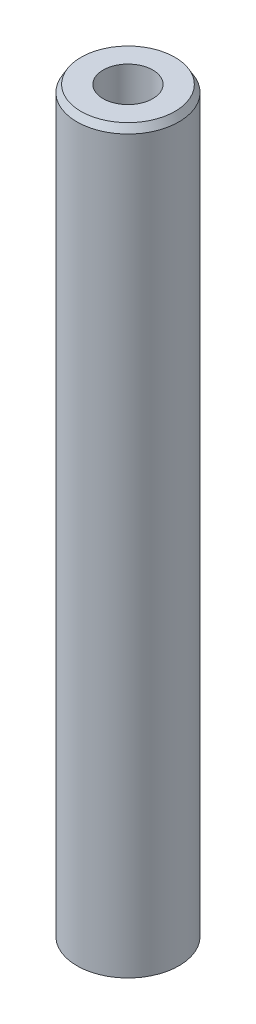
from build123d import *
from OCP.BRepFilletAPI import BRepFilletAPI_MakeChamfer

# Parameters (mm, degrees)
SKETCH1_R           = 7.5
BOSS_EXTRUDE1_DEPTH = 109.103731088
SKETCH2_R           = 3.653436634
CUT_EXTRUDE1_DEPTH  = 110.618083076
CHAMFER1_SIZE       = 1.032537597
CHAMFER1_SIZE2      = 0.596135859


with BuildPart() as part:
    # Sketch1 → Boss-Extrude1 (new body)
    with BuildSketch(Plane(origin=(0, 0, 0), x_dir=(1, 0, 0), z_dir=(0, 1, 0))):
        Circle(SKETCH1_R)
    extrude(amount=BOSS_EXTRUDE1_DEPTH)

    # Sketch2 → Cut-Extrude1 (cut, through all)
    with BuildSketch(Plane(origin=(0, 0, 0), x_dir=(1, 0, 0), z_dir=(0, 1, 0))):
        Circle(SKETCH2_R)
    extrude(amount=CUT_EXTRUDE1_DEPTH, mode=Mode.SUBTRACT)

    # Chamfer1: one chamfer whose edges measure the first distance from different faces: ONE call of the kernel's chamfer builder (chamfer() names one face for all edges)
    chamfer1_edges_1 = [part.edges().sort_by_distance(p)[0] for p in [
        (-7.5, 109.103731088, 0),
    ]]
    chamfer1_side_1 = [part.faces().sort_by_distance(p)[0] for p in [
        (-7.5, 54.551865544, 0),
    ]]
    chamfer1_edges_2 = [part.edges().sort_by_distance(p)[0] for p in [
        (-7.5, 0, 0),
    ]]
    chamfer1_side_2 = [part.faces().sort_by_distance(p)[0] for p in [
        (-7.287867966, 0, 0),
    ]]
    chamfer1 = BRepFilletAPI_MakeChamfer(part.part.solid().wrapped)
    for e in chamfer1_edges_1:
        chamfer1.Add(CHAMFER1_SIZE, CHAMFER1_SIZE2, e.wrapped, chamfer1_side_1[0].wrapped)  # the first distance lies on this face
    for e in chamfer1_edges_2:
        chamfer1.Add(CHAMFER1_SIZE, CHAMFER1_SIZE2, e.wrapped, chamfer1_side_2[0].wrapped)  # the first distance lies on this face
    add(Compound.cast(chamfer1.Shape()), mode=Mode.REPLACE)


solid = part.part
